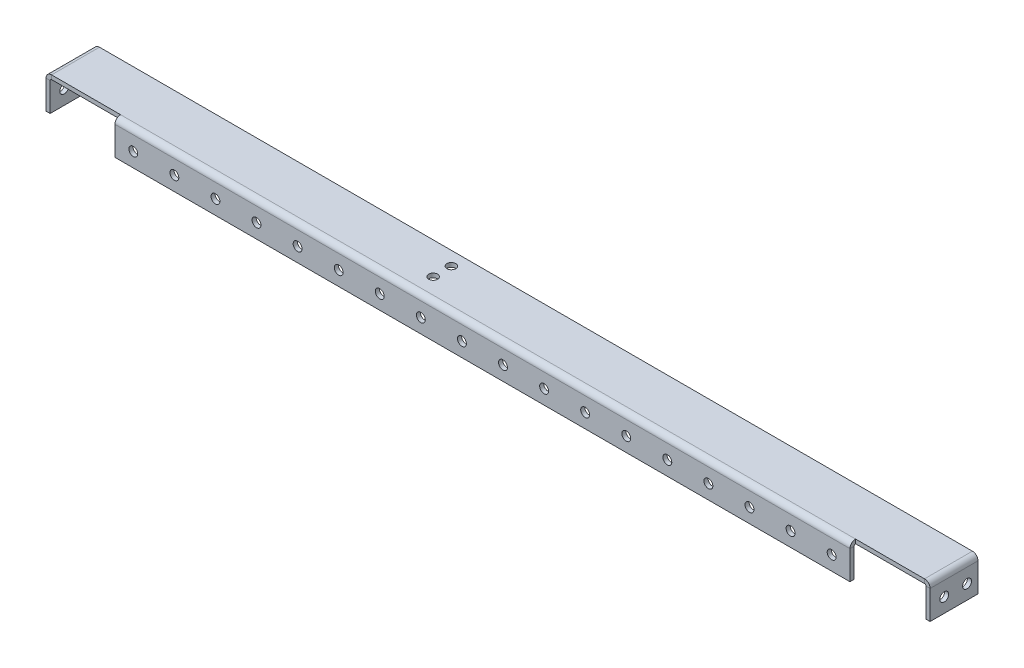
from build123d import *

# Parameters (mm, degrees)
SKETCH1_W                    = 489.688000048
SKETCH1_H                    = 26.67
BASE_FLANGE1_DEPTH           = 2.286
EDGE_FLANGE2_STRIP_W         = 10.7696
EDGE_FLANGE2_STRIP_H         = 2.286
EDGE_FLANGE2_STRIP_CUT_DEPTH = 26.67
EDGE_FLANGE2_DEPTH           = 26.67
EDGE_FLANGE3_STRIP_W         = 10.7696
EDGE_FLANGE3_STRIP_H         = 2.286
EDGE_FLANGE3_STRIP_CUT_DEPTH = 26.67
EDGE_FLANGE3_DEPTH           = 26.67
EDGE_FLANGE1_DEPTH           = 485.776400048
SKETCH16_R                   = 2.4765
CUT_EXTRUDE1_DEPTH           = 494.064507061
CUT_EXTRUDE2_DEPTH           = 0.8128
CUT_EXTRUDE2_DEPTH_BACK      = 2.54
SKETCH17_W                   = 38.3794
SKETCH17_H                   = 19.05
CUT_EXTRUDE3_REACH           = 495.109
SKETCH18_R                   = 2.4765
CUT_EXTRUDE4_REACH           = 494.981
SKETCH19_R                   = 2.4765


# Sheet-metal steps are written as plain solids
with BuildPart() as part:
    # Sketch1 → Base-Flange1 (new body)
    with BuildSketch(Plane(origin=(0, 0, 0), x_dir=(1, 0, 0), z_dir=(0, 1, 0))):
        with Locations((244.844000024, 13.335)):
            Rectangle(SKETCH1_W, SKETCH1_H)
    extrude(amount=-BASE_FLANGE1_DEPTH)

    # Edge-Flange2 strip (across the edge) → Edge-Flange2 strip cut (cut)
    with BuildSketch(Plane(origin=(0, -2.286, 0), x_dir=(1, 0, 0), z_dir=(0, 0, -1))):
        with Locations((-2.286, -1.143)):
            Rectangle(EDGE_FLANGE2_STRIP_W, EDGE_FLANGE2_STRIP_H)
    extrude(amount=EDGE_FLANGE2_STRIP_CUT_DEPTH, mode=Mode.SUBTRACT)

    # Edge-Flange2 section (across the edge) → Edge-Flange2 (add)
    with BuildSketch(Plane(origin=(0, -2.286, 0), x_dir=(1, 0, 0), z_dir=(0, 0, -1))):
        with BuildLine():
            Line((0, 0.8128), (0, 16.764))
            Line((0, 16.764), (2.286, 16.764))
            Line((2.286, 16.764), (2.286, 0.8128))
            ThreePointArc((2.286, 0.8128), (2.524063608, 0.238063608), (3.0988, 0))
            Line((3.0988, 0), (3.0988, -2.286))
            ThreePointArc((3.0988, -2.286), (0.907617506, -1.378382494), (0, 0.8128))
        make_face()
    extrude(amount=EDGE_FLANGE2_DEPTH)

    # Edge-Flange3 strip (across the edge) → Edge-Flange3 strip cut (cut)
    with BuildSketch(Plane(origin=(489.688000048, -2.286, -26.67), x_dir=(-1, 0, 0), z_dir=(0, 0, 1))):
        with Locations((-4.572, -1.143)):
            Rectangle(EDGE_FLANGE3_STRIP_W, EDGE_FLANGE3_STRIP_H)
    extrude(amount=EDGE_FLANGE3_STRIP_CUT_DEPTH, mode=Mode.SUBTRACT)

    # Edge-Flange3 section (across the edge) → Edge-Flange3 (add)
    with BuildSketch(Plane(origin=(489.688000048, -2.286, -26.67), x_dir=(-1, 0, 0), z_dir=(0, 0, 1))):
        with BuildLine():
            Line((-2.286, 0.8128), (-2.286, 16.764))
            Line((-2.286, 16.764), (0, 16.764))
            Line((0, 16.764), (0, 0.8128))
            ThreePointArc((0, 0.8128), (0.238063608, 0.238063608), (0.8128, 0))
            Line((0.8128, 0), (0.8128, -2.286))
            ThreePointArc((0.8128, -2.286), (-1.378382494, -1.378382494), (-2.286, 0.8128))
        make_face()
    extrude(amount=EDGE_FLANGE3_DEPTH)

    # Edge-Flange1 section (across the edge) → Edge-Flange1 (add)
    with BuildSketch(Plane(origin=(488.875200048, -2.286, 0.8128), x_dir=(0, 0, -1), z_dir=(-1, 0, 0))):
        with BuildLine():
            Line((-2.286, 0.8128), (-2.286, 16.764))
            Line((-2.286, 16.764), (0, 16.764))
            Line((0, 16.764), (0, 0.8128))
            ThreePointArc((0, 0.8128), (0.238063608, 0.238063608), (0.8128, 0))
            Line((0.8128, 0), (0.8128, -2.286))
            ThreePointArc((0.8128, -2.286), (-1.378382494, -1.378382494), (-2.286, 0.8128))
        make_face()
    extrude(amount=EDGE_FLANGE1_DEPTH)

    # Sketch16 → Cut-Extrude1 (cut, through all)
    with BuildSketch(Plane(origin=(491.974000048, 0, 0), x_dir=(0, 0, -1), z_dir=(1, 0, 0))):
        with Locations(Location((7.874, -11.0744, 0), (0, 0, 90))):
            Circle(SKETCH16_R)
        with Locations(Location((20.574, -11.0744, 0), (0, 0, 90))):
            Circle(SKETCH16_R)
    extrude(amount=-CUT_EXTRUDE1_DEPTH, mode=Mode.SUBTRACT)

    # Sketch17 → Cut-Extrude2 (cut, two sides: drawn at the far end of the back side and taken through both)
    with BuildSketch(Plane(origin=(0, 0, 0.8128), x_dir=(-1, 0, 0), z_dir=(0, 0, -1)).offset(-CUT_EXTRUDE2_DEPTH_BACK)):
        with Locations((-22.2885, -9.525)):
            Rectangle(SKETCH17_W, SKETCH17_H)
        with Locations((-469.685500048, -9.525)):
            Rectangle(SKETCH17_W, SKETCH17_H)
    extrude(amount=CUT_EXTRUDE2_DEPTH + CUT_EXTRUDE2_DEPTH_BACK, mode=Mode.SUBTRACT)

    # Sketch18 → Cut-Extrude3 (cut, up to next)
    with BuildSketch(Plane(origin=(0, 0, 0.8128), x_dir=(-1, 0, 0), z_dir=(0, 0, -1)), mode=Mode.PRIVATE) as cut_extrude3_sk1:
        with Locations(Location((-440.297000024, -11.0744, 0), (0, 0, 90))):
            Circle(SKETCH18_R)
    cut_extrude3_tool1 = extrude(cut_extrude3_sk1.sketch, amount=-CUT_EXTRUDE3_REACH, mode=Mode.PRIVATE) & part.part
    # Sketch18 → Cut-Extrude3 (cut, up to next)
    with BuildSketch(Plane(origin=(0, 0, 0.8128), x_dir=(-1, 0, 0), z_dir=(0, 0, -1)), mode=Mode.PRIVATE) as cut_extrude3_sk2:
        with Locations(Location((-417.437000024, -11.0744, 0), (0, 0, 90))):
            Circle(SKETCH18_R)
    cut_extrude3_tool2 = extrude(cut_extrude3_sk2.sketch, amount=-CUT_EXTRUDE3_REACH, mode=Mode.PRIVATE) & part.part
    # Sketch18 → Cut-Extrude3 (cut, up to next)
    with BuildSketch(Plane(origin=(0, 0, 0.8128), x_dir=(-1, 0, 0), z_dir=(0, 0, -1)), mode=Mode.PRIVATE) as cut_extrude3_sk3:
        with Locations(Location((-394.577000024, -11.0744, 0), (0, 0, 90))):
            Circle(SKETCH18_R)
    cut_extrude3_tool3 = extrude(cut_extrude3_sk3.sketch, amount=-CUT_EXTRUDE3_REACH, mode=Mode.PRIVATE) & part.part
    # Sketch18 → Cut-Extrude3 (cut, up to next)
    with BuildSketch(Plane(origin=(0, 0, 0.8128), x_dir=(-1, 0, 0), z_dir=(0, 0, -1)), mode=Mode.PRIVATE) as cut_extrude3_sk4:
        with Locations(Location((-371.717000024, -11.0744, 0), (0, 0, 90))):
            Circle(SKETCH18_R)
    cut_extrude3_tool4 = extrude(cut_extrude3_sk4.sketch, amount=-CUT_EXTRUDE3_REACH, mode=Mode.PRIVATE) & part.part
    # Sketch18 → Cut-Extrude3 (cut, up to next)
    with BuildSketch(Plane(origin=(0, 0, 0.8128), x_dir=(-1, 0, 0), z_dir=(0, 0, -1)), mode=Mode.PRIVATE) as cut_extrude3_sk5:
        with Locations(Location((-348.857000024, -11.0744, 0), (0, 0, 90))):
            Circle(SKETCH18_R)
    cut_extrude3_tool5 = extrude(cut_extrude3_sk5.sketch, amount=-CUT_EXTRUDE3_REACH, mode=Mode.PRIVATE) & part.part
    # Sketch18 → Cut-Extrude3 (cut, up to next)
    with BuildSketch(Plane(origin=(0, 0, 0.8128), x_dir=(-1, 0, 0), z_dir=(0, 0, -1)), mode=Mode.PRIVATE) as cut_extrude3_sk6:
        with Locations(Location((-325.997000024, -11.0744, 0), (0, 0, 90))):
            Circle(SKETCH18_R)
    cut_extrude3_tool6 = extrude(cut_extrude3_sk6.sketch, amount=-CUT_EXTRUDE3_REACH, mode=Mode.PRIVATE) & part.part
    # Sketch18 → Cut-Extrude3 (cut, up to next)
    with BuildSketch(Plane(origin=(0, 0, 0.8128), x_dir=(-1, 0, 0), z_dir=(0, 0, -1)), mode=Mode.PRIVATE) as cut_extrude3_sk7:
        with Locations(Location((-303.137000024, -11.0744, 0), (0, 0, 90))):
            Circle(SKETCH18_R)
    cut_extrude3_tool7 = extrude(cut_extrude3_sk7.sketch, amount=-CUT_EXTRUDE3_REACH, mode=Mode.PRIVATE) & part.part
    # Sketch18 → Cut-Extrude3 (cut, up to next)
    with BuildSketch(Plane(origin=(0, 0, 0.8128), x_dir=(-1, 0, 0), z_dir=(0, 0, -1)), mode=Mode.PRIVATE) as cut_extrude3_sk8:
        with Locations(Location((-280.277000024, -11.0744, 0), (0, 0, 90))):
            Circle(SKETCH18_R)
    cut_extrude3_tool8 = extrude(cut_extrude3_sk8.sketch, amount=-CUT_EXTRUDE3_REACH, mode=Mode.PRIVATE) & part.part
    # Sketch18 → Cut-Extrude3 (cut, up to next)
    with BuildSketch(Plane(origin=(0, 0, 0.8128), x_dir=(-1, 0, 0), z_dir=(0, 0, -1)), mode=Mode.PRIVATE) as cut_extrude3_sk9:
        with Locations(Location((-257.417000024, -11.0744, 0), (0, 0, 90))):
            Circle(SKETCH18_R)
    cut_extrude3_tool9 = extrude(cut_extrude3_sk9.sketch, amount=-CUT_EXTRUDE3_REACH, mode=Mode.PRIVATE) & part.part
    # Sketch18 → Cut-Extrude3 (cut, up to next)
    with BuildSketch(Plane(origin=(0, 0, 0.8128), x_dir=(-1, 0, 0), z_dir=(0, 0, -1)), mode=Mode.PRIVATE) as cut_extrude3_sk10:
        with Locations(Location((-234.557000024, -11.0744, 0), (0, 0, 90))):
            Circle(SKETCH18_R)
    cut_extrude3_tool10 = extrude(cut_extrude3_sk10.sketch, amount=-CUT_EXTRUDE3_REACH, mode=Mode.PRIVATE) & part.part
    # Sketch18 → Cut-Extrude3 (cut, up to next)
    with BuildSketch(Plane(origin=(0, 0, 0.8128), x_dir=(-1, 0, 0), z_dir=(0, 0, -1)), mode=Mode.PRIVATE) as cut_extrude3_sk11:
        with Locations(Location((-211.697000024, -11.0744, 0), (0, 0, 90))):
            Circle(SKETCH18_R)
    cut_extrude3_tool11 = extrude(cut_extrude3_sk11.sketch, amount=-CUT_EXTRUDE3_REACH, mode=Mode.PRIVATE) & part.part
    # Sketch18 → Cut-Extrude3 (cut, up to next)
    with BuildSketch(Plane(origin=(0, 0, 0.8128), x_dir=(-1, 0, 0), z_dir=(0, 0, -1)), mode=Mode.PRIVATE) as cut_extrude3_sk12:
        with Locations(Location((-188.837000024, -11.0744, 0), (0, 0, 90))):
            Circle(SKETCH18_R)
    cut_extrude3_tool12 = extrude(cut_extrude3_sk12.sketch, amount=-CUT_EXTRUDE3_REACH, mode=Mode.PRIVATE) & part.part
    # Sketch18 → Cut-Extrude3 (cut, up to next)
    with BuildSketch(Plane(origin=(0, 0, 0.8128), x_dir=(-1, 0, 0), z_dir=(0, 0, -1)), mode=Mode.PRIVATE) as cut_extrude3_sk13:
        with Locations(Location((-165.977000024, -11.0744, 0), (0, 0, 90))):
            Circle(SKETCH18_R)
    cut_extrude3_tool13 = extrude(cut_extrude3_sk13.sketch, amount=-CUT_EXTRUDE3_REACH, mode=Mode.PRIVATE) & part.part
    # Sketch18 → Cut-Extrude3 (cut, up to next)
    with BuildSketch(Plane(origin=(0, 0, 0.8128), x_dir=(-1, 0, 0), z_dir=(0, 0, -1)), mode=Mode.PRIVATE) as cut_extrude3_sk14:
        with Locations(Location((-143.117000024, -11.0744, 0), (0, 0, 90))):
            Circle(SKETCH18_R)
    cut_extrude3_tool14 = extrude(cut_extrude3_sk14.sketch, amount=-CUT_EXTRUDE3_REACH, mode=Mode.PRIVATE) & part.part
    # Sketch18 → Cut-Extrude3 (cut, up to next)
    with BuildSketch(Plane(origin=(0, 0, 0.8128), x_dir=(-1, 0, 0), z_dir=(0, 0, -1)), mode=Mode.PRIVATE) as cut_extrude3_sk15:
        with Locations(Location((-120.257000024, -11.0744, 0), (0, 0, 90))):
            Circle(SKETCH18_R)
    cut_extrude3_tool15 = extrude(cut_extrude3_sk15.sketch, amount=-CUT_EXTRUDE3_REACH, mode=Mode.PRIVATE) & part.part
    # Sketch18 → Cut-Extrude3 (cut, up to next)
    with BuildSketch(Plane(origin=(0, 0, 0.8128), x_dir=(-1, 0, 0), z_dir=(0, 0, -1)), mode=Mode.PRIVATE) as cut_extrude3_sk16:
        with Locations(Location((-97.397000024, -11.0744, 0), (0, 0, 90))):
            Circle(SKETCH18_R)
    cut_extrude3_tool16 = extrude(cut_extrude3_sk16.sketch, amount=-CUT_EXTRUDE3_REACH, mode=Mode.PRIVATE) & part.part
    # Sketch18 → Cut-Extrude3 (cut, up to next)
    with BuildSketch(Plane(origin=(0, 0, 0.8128), x_dir=(-1, 0, 0), z_dir=(0, 0, -1)), mode=Mode.PRIVATE) as cut_extrude3_sk17:
        with Locations(Location((-74.537000024, -11.0744, 0), (0, 0, 90))):
            Circle(SKETCH18_R)
    cut_extrude3_tool17 = extrude(cut_extrude3_sk17.sketch, amount=-CUT_EXTRUDE3_REACH, mode=Mode.PRIVATE) & part.part
    # Sketch18 → Cut-Extrude3 (cut, up to next)
    with BuildSketch(Plane(origin=(0, 0, 0.8128), x_dir=(-1, 0, 0), z_dir=(0, 0, -1)), mode=Mode.PRIVATE) as cut_extrude3_sk18:
        with Locations(Location((-51.677000024, -11.0744, 0), (0, 0, 90))):
            Circle(SKETCH18_R)
    cut_extrude3_tool18 = extrude(cut_extrude3_sk18.sketch, amount=-CUT_EXTRUDE3_REACH, mode=Mode.PRIVATE) & part.part
    add(cut_extrude3_tool1.solids().sort_by_distance((440.297, -11.0744, 0.8128))[0], mode=Mode.SUBTRACT)
    add(cut_extrude3_tool2.solids().sort_by_distance((417.437, -11.0744, 0.8128))[0], mode=Mode.SUBTRACT)
    add(cut_extrude3_tool3.solids().sort_by_distance((394.577, -11.0744, 0.8128))[0], mode=Mode.SUBTRACT)
    add(cut_extrude3_tool4.solids().sort_by_distance((371.717, -11.0744, 0.8128))[0], mode=Mode.SUBTRACT)
    add(cut_extrude3_tool5.solids().sort_by_distance((348.857, -11.0744, 0.8128))[0], mode=Mode.SUBTRACT)
    add(cut_extrude3_tool6.solids().sort_by_distance((325.997, -11.0744, 0.8128))[0], mode=Mode.SUBTRACT)
    add(cut_extrude3_tool7.solids().sort_by_distance((303.137, -11.0744, 0.8128))[0], mode=Mode.SUBTRACT)
    add(cut_extrude3_tool8.solids().sort_by_distance((280.277, -11.0744, 0.8128))[0], mode=Mode.SUBTRACT)
    add(cut_extrude3_tool9.solids().sort_by_distance((257.417, -11.0744, 0.8128))[0], mode=Mode.SUBTRACT)
    add(cut_extrude3_tool10.solids().sort_by_distance((234.557, -11.0744, 0.8128))[0], mode=Mode.SUBTRACT)
    add(cut_extrude3_tool11.solids().sort_by_distance((211.697, -11.0744, 0.8128))[0], mode=Mode.SUBTRACT)
    add(cut_extrude3_tool12.solids().sort_by_distance((188.837, -11.0744, 0.8128))[0], mode=Mode.SUBTRACT)
    add(cut_extrude3_tool13.solids().sort_by_distance((165.977, -11.0744, 0.8128))[0], mode=Mode.SUBTRACT)
    add(cut_extrude3_tool14.solids().sort_by_distance((143.117, -11.0744, 0.8128))[0], mode=Mode.SUBTRACT)
    add(cut_extrude3_tool15.solids().sort_by_distance((120.257, -11.0744, 0.8128))[0], mode=Mode.SUBTRACT)
    add(cut_extrude3_tool16.solids().sort_by_distance((97.397, -11.0744, 0.8128))[0], mode=Mode.SUBTRACT)
    add(cut_extrude3_tool17.solids().sort_by_distance((74.537, -11.0744, 0.8128))[0], mode=Mode.SUBTRACT)
    add(cut_extrude3_tool18.solids().sort_by_distance((51.677, -11.0744, 0.8128))[0], mode=Mode.SUBTRACT)

    # Sketch19 → Cut-Extrude4 (cut, up to next)
    with BuildSketch(Plane.XZ.offset(2.286), mode=Mode.PRIVATE) as cut_extrude4_sk1:
        with Locations(Location((206.542782059, -19.0612, 0), (0, 0, 270))):
            Circle(SKETCH19_R)
    cut_extrude4_tool1 = extrude(cut_extrude4_sk1.sketch, amount=-CUT_EXTRUDE4_REACH, mode=Mode.PRIVATE) & part.part
    # Sketch19 → Cut-Extrude4 (cut, up to next)
    with BuildSketch(Plane.XZ.offset(2.286), mode=Mode.PRIVATE) as cut_extrude4_sk2:
        with Locations(Location((206.542782059, -8.9012, 0), (0, 0, 270))):
            Circle(SKETCH19_R)
    cut_extrude4_tool2 = extrude(cut_extrude4_sk2.sketch, amount=-CUT_EXTRUDE4_REACH, mode=Mode.PRIVATE) & part.part
    add(cut_extrude4_tool1.solids().sort_by_distance((206.542782, -2.286, -19.0612))[0], mode=Mode.SUBTRACT)
    add(cut_extrude4_tool2.solids().sort_by_distance((206.542782, -2.286, -8.9012))[0], mode=Mode.SUBTRACT)


solid = part.part
